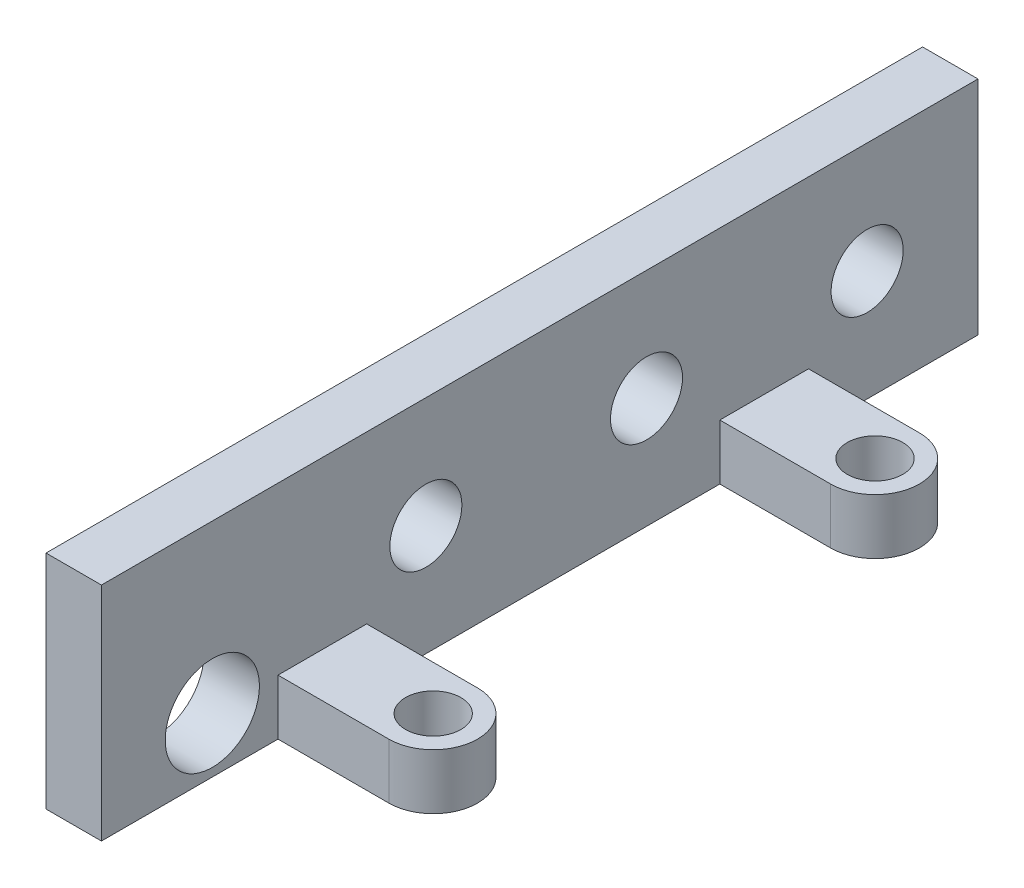
from build123d import *

# Parameters (mm, degrees)
SKETCH1_W           = 79.06161987
SKETCH1_H           = 20
SKETCH1_R           = 3.25
SKETCH1_R_2         = 4.25
BOSS_EXTRUDE1_DEPTH = 5
SKETCH2_W           = 8
SKETCH2_H           = 5
BOSS_EXTRUDE2_DEPTH = 10
BOSS_EXTRUDE3_DEPTH = 5
SKETCH3_6_R         = 2.5
CUT_EXTRUDE2_DEPTH  = 83.684579798


with BuildPart() as part:
    # Sketch1 → Boss-Extrude1 (new body)
    with BuildSketch(Plane(origin=(0, 0, 0), x_dir=(0, 0, -1), z_dir=(1, 0, 0))):
        with Locations((-39.530809935, 10)):
            Rectangle(SKETCH1_W, SKETCH1_H)
        with Locations((-29.9, 10)):
            Circle(SKETCH1_R, mode=Mode.SUBTRACT)
        with Locations((-49.8, 10)):
            Circle(SKETCH1_R, mode=Mode.SUBTRACT)
        with Locations((-69.06161987, 5)):
            Circle(SKETCH1_R_2, mode=Mode.SUBTRACT)
        with Locations((-10, 10)):
            Circle(SKETCH1_R, mode=Mode.SUBTRACT)
    extrude(amount=BOSS_EXTRUDE1_DEPTH)

    # Sketch2 → Boss-Extrude2 (add)
    with BuildSketch(Plane(origin=(5, 0, 0), x_dir=(0, 0, -1), z_dir=(1, 0, 0))):
        with Locations((-19.28661987, 2.5)):
            Rectangle(SKETCH2_W, SKETCH2_H)
        with Locations((-59.13661987, 2.5)):
            Rectangle(SKETCH2_W, SKETCH2_H)
    extrude(amount=BOSS_EXTRUDE2_DEPTH)

    # Sketch3 → Boss-Extrude3 (add)
    with BuildSketch(Plane(origin=(0, 5, 0), x_dir=(1, 0, 0), z_dir=(0, 1, 0))):
        with BuildLine():
            Line((15, -55.13661987), (15, -63.13661987))
            ThreePointArc((15, -63.13661987), (19, -59.13661987), (15, -55.13661987))
        make_face()
    boss_extrude3 = extrude(amount=-BOSS_EXTRUDE3_DEPTH)

    # Sketch3<6> → Cut-Extrude2 (cut, through all)
    with BuildSketch(Plane(origin=(0, 5, 0), x_dir=(1, 0, 0), z_dir=(0, 1, 0))):
        with Locations((15, -59.13661987)):
            Circle(SKETCH3_6_R)
    cut_extrude2 = extrude(amount=-CUT_EXTRUDE2_DEPTH, mode=Mode.SUBTRACT)

    # Mirror1: Boss-Extrude3, Cut-Extrude2 across plane
    add(boss_extrude3.mirror(Plane.XY.offset(39.21161987)))
    add(cut_extrude2.mirror(Plane.XY.offset(39.21161987)), mode=Mode.SUBTRACT)


solid = part.part
